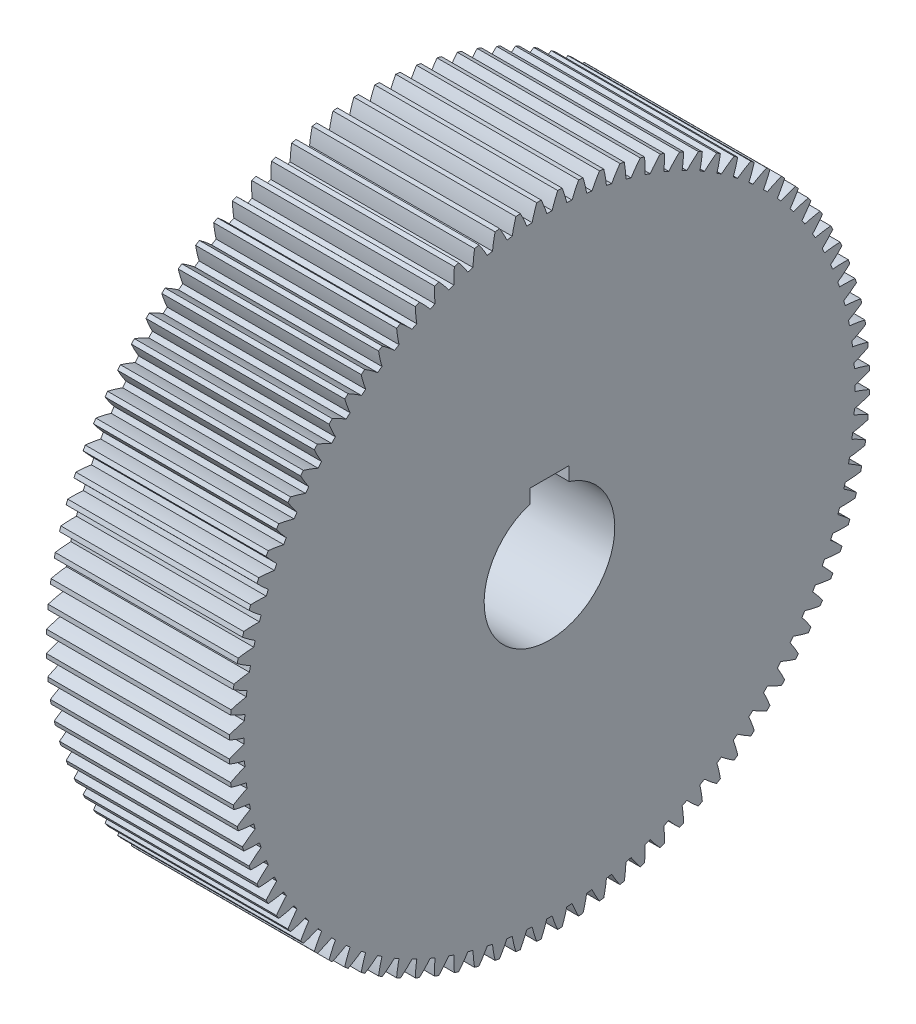
from build123d import *

# Parameters (mm, degrees)
BASPROSKE_W     = 56
BASPROSKE_H     = 98
TOOTHCUT_DEPTH  = 150.479095528
TEETHCUTS_COUNT = 96
TEETHCUTS_ANGLE = 356.25
BORSKE_R        = 20
BORE_DEPTH      = 56.0000508
KEYSKE_W        = 12
KEYSKE_H        = 23.3
KEYWAY_DEPTH    = 56.0000508


with BuildPart() as part:
    # BasProSke → Base-Revolve (revolve)
    with BuildSketch(Plane(origin=(0, 0, 0), x_dir=(1, 0, 0), z_dir=(0, 1, 0))):
        with Locations((28, 49)):
            Rectangle(BASPROSKE_W, BASPROSKE_H)
    revolve(axis=Axis((-10, 0, 0), (1, 0, 0)))

    # TooCutSke → ToothCut (cut, through all)
    with BuildSketch(Plane(origin=(0, 0, 0), x_dir=(0, 0, -1), z_dir=(1, 0, 0))):
        with BuildLine():
            ThreePointArc((0.816302804, 93.495436524), (0, 93.499), (-0.816302804, 93.495436524))
            ThreePointArc((-0.816302804, 93.495436524), (-1.605364709, 95.770990559), (-2.535528881, 97.992602468))
            ThreePointArc((-2.535528881, 97.992602468), (0, 98.0254), (2.535528881, 97.992602468))
            ThreePointArc((2.535528881, 97.992602468), (1.605364709, 95.770990559), (0.816302804, 93.495436524))
        make_face()
    toothcut = extrude(amount=TOOTHCUT_DEPTH, mode=Mode.SUBTRACT)

    # TeethCuts: ToothCut ×96 about axis
    teethcuts_axis = Axis((-10, 0, 0), (1, 0, 0))
    for i in range(1, TEETHCUTS_COUNT):
        add(toothcut.rotate(teethcuts_axis, i * TEETHCUTS_ANGLE / (TEETHCUTS_COUNT - 1)), mode=Mode.SUBTRACT)

    # BorSke → Bore (cut, symmetric)
    with BuildSketch(Plane(origin=(0, 0, 0), x_dir=(0, 0, -1), z_dir=(1, 0, 0))):
        Circle(BORSKE_R)
    extrude(amount=BORE_DEPTH, both=True, mode=Mode.SUBTRACT)

    # KeySke → Keyway (cut, symmetric)
    with BuildSketch(Plane(origin=(0, 0, 0), x_dir=(0, 0, -1), z_dir=(1, 0, 0))):
        with Locations((0, 11.65)):
            Rectangle(KEYSKE_W, KEYSKE_H)
    extrude(amount=KEYWAY_DEPTH, both=True, mode=Mode.SUBTRACT)


solid = part.part
